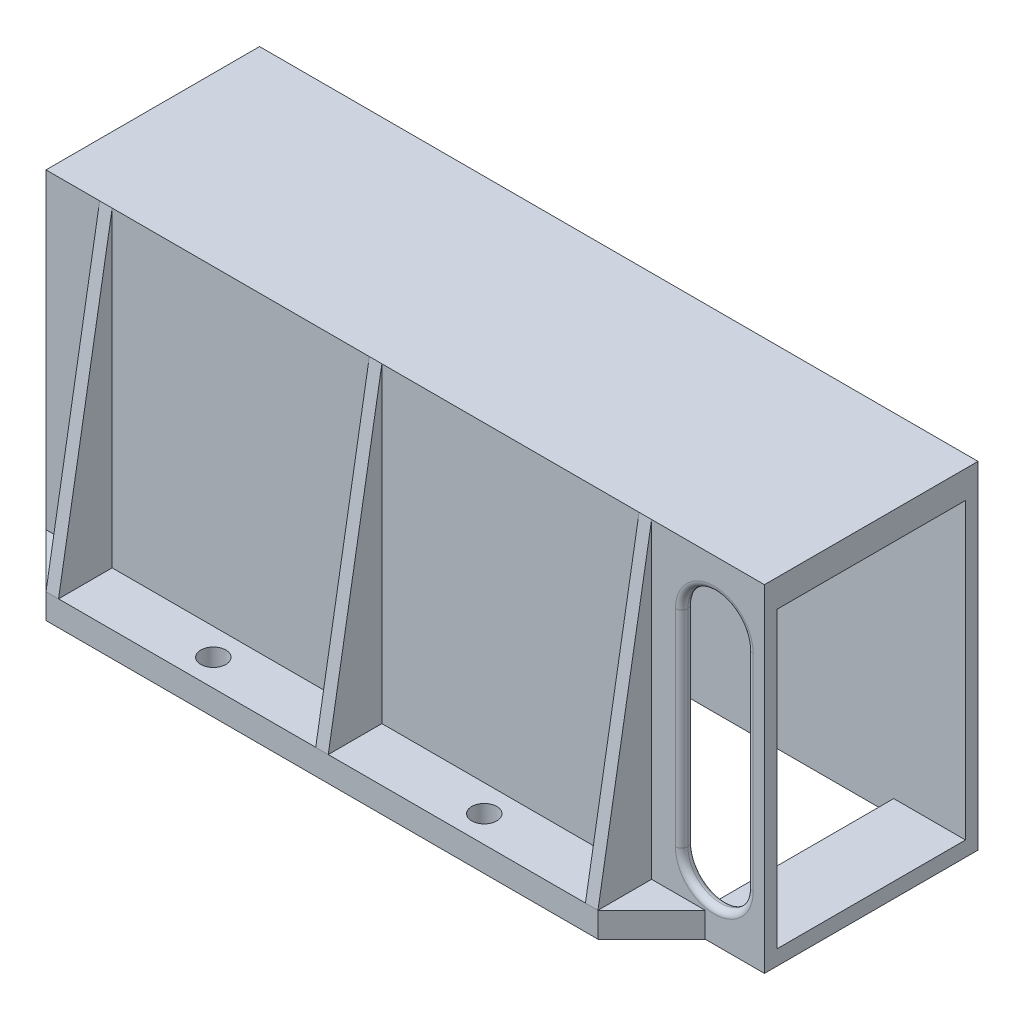
from build123d import *

# Parameters (mm, degrees)
SKETCH1_W                 = 166.85
SKETCH1_H                 = 54.05
SKETCH1_W_2               = 160.5
SKETCH1_H_2               = 47.7
BOSS_EXTRUDE1_DEPTH       = 3.81
BOSS_EXTRUDE2_DEPTH       = 78.232
SKETCH3_W                 = 166.85
SKETCH3_H                 = 54.05
BOSS_EXTRUDE5_DEPTH       = 3.175
SKETCH4_W                 = 3.175
SKETCH4_H                 = 54.05
BOSS_EXTRUDE6_DEPTH       = 3.81
BOSS_EXTRUDE7_DEPTH       = 6.35
BOSS_EXTRUDE9_DEPTH       = 3.175
BOSS_EXTRUDE10_DEPTH      = 3.175
SKETCH8_R                 = 3.175
CUT_EXTRUDE1_DEPTH        = 122.77066278
BOSS_EXTRUDE11_DEPTH      = 1.5875
BOSS_EXTRUDE11_DEPTH_BACK = 1.5875
SKETCH14_W                = 54.05
SKETCH14_H                = 85.217
SKETCH14_W_2              = 47.7
SKETCH14_H_2              = 74.422
BOSS_EXTRUDE13_DEPTH      = 14.986
CUT_EXTRUDE2_DEPTH        = 147.696293869
SKETCH16_W                = 160.5
SKETCH16_H                = 47.7
CUT_EXTRUDE3_DEPTH        = 1.5875
SKETCH17_W                = 18.712657602
SKETCH17_H                = 69.277031054
BOSS_EXTRUDE14_DEPTH      = 3.175
FILLET1_R                 = 1.5875


with BuildPart() as part:
    # Sketch1 → Boss-Extrude1 (new body)
    with BuildSketch(Plane(origin=(0, 0, 0), x_dir=(1, 0, 0), z_dir=(0, 1, 0))):
        Rectangle(SKETCH1_W, SKETCH1_H)
        Rectangle(SKETCH1_W_2, SKETCH1_H_2, mode=Mode.SUBTRACT)
    extrude(amount=BOSS_EXTRUDE1_DEPTH)

    # Sketch2 → Boss-Extrude2 (add)
    with BuildSketch(Plane(origin=(0, 3.81, 0), x_dir=(1, 0, 0), z_dir=(0, 1, 0))):
        Polygon((-83.425, 27.025), (83.425, 27.025), (83.425, 23.85), (80.25, 23.85), (-80.25, 23.85), (-80.25, -23.85), (80.25, -23.85), (83.425, -23.85), (83.425, -27.025), (-83.425, -27.025), align=None)
    extrude(amount=BOSS_EXTRUDE2_DEPTH)

    # Sketch3 → Boss-Extrude5 (add)
    with BuildSketch(Plane(origin=(0, 82.042, 0), x_dir=(1, 0, 0), z_dir=(0, 1, 0))):
        Rectangle(SKETCH3_W, SKETCH3_H)
    extrude(amount=BOSS_EXTRUDE5_DEPTH)

    # Sketch4 → Boss-Extrude6 (add)
    with BuildSketch(Plane.XZ.offset(-82.042)):
        with Locations((81.8375, 0)):
            Rectangle(SKETCH4_W, SKETCH4_H)
    extrude(amount=BOSS_EXTRUDE6_DEPTH)

    # Sketch5 → Boss-Extrude7 (add)
    with BuildSketch(Plane(origin=(0, 0, 0), x_dir=(1, 0, 0), z_dir=(0, 1, 0))):
        Polygon((-83.425, -27.025), (83.425, -27.025), (69.85, -40.6), (-69.85, -40.6), align=None)
        Polygon((-69.85, 40.6), (-83.425, 27.025), (83.425, 27.025), (69.85, 40.6), align=None)
    extrude(amount=BOSS_EXTRUDE7_DEPTH)

    # Sketch6 → Boss-Extrude9 (add)
    with BuildSketch(Plane.ZY.offset(69.85)):
        Polygon((27.025, 85.217), (27.025, 6.35), (40.6, 6.35), align=None)
        Polygon((-27.025, 85.217), (-40.6, 6.35), (-27.025, 6.35), align=None)
    extrude(amount=-BOSS_EXTRUDE9_DEPTH)

    # Sketch7 → Boss-Extrude10 (add)
    with BuildSketch(Plane(origin=(69.85, 0, 0), x_dir=(0, 0, -1), z_dir=(1, 0, 0))):
        Polygon((-27.025, 85.217), (-27.025, 6.35), (-40.6, 6.35), align=None)
        Polygon((40.6, 6.35), (27.025, 85.217), (27.025, 6.35), align=None)
    extrude(amount=-BOSS_EXTRUDE10_DEPTH)

    # Sketch8 → Cut-Extrude1 (cut, through all)
    with BuildSketch(Plane(origin=(0, 6.35, 0), x_dir=(1, 0, 0), z_dir=(0, 1, 0))):
        with Locations(Location((-34.29, -33.812500014, 0), (0, 0, 270))):
            Circle(SKETCH8_R)
        with Locations(Location((34.29, -33.812500014, 0), (0, 0, 90))):
            Circle(SKETCH8_R)
        with Locations(Location((34.29, 33.812500014, 0), (0, 0, 270))):
            Circle(SKETCH8_R)
        with Locations(Location((-34.29, 33.812500014, 0), (0, 0, 90))):
            Circle(SKETCH8_R)
    extrude(amount=-CUT_EXTRUDE1_DEPTH, mode=Mode.SUBTRACT)

    # Sketch11 → Boss-Extrude11 (add, two sides: drawn at the far end of the back side and taken through both)
    with BuildSketch(Plane(origin=(0, 0, 0), x_dir=(0, 0, -1), z_dir=(1, 0, 0)).offset(-BOSS_EXTRUDE11_DEPTH_BACK)):
        Polygon((-27.025, 85.217), (-27.025, 6.35), (-40.6, 6.35), align=None)
        Polygon((40.6, 6.35), (27.025, 85.217), (27.025, 6.35), align=None)
    extrude(amount=BOSS_EXTRUDE11_DEPTH + BOSS_EXTRUDE11_DEPTH_BACK)

    # Sketch14 → Boss-Extrude13 (add)
    with BuildSketch(Plane(origin=(98.411, 0, 0), x_dir=(0, 0, -1), z_dir=(1, 0, 0))):
        with Locations((0, 42.6085)):
            Rectangle(SKETCH14_W, SKETCH14_H)
        with Locations((0, 41.021)):
            Rectangle(SKETCH14_W_2, SKETCH14_H_2, mode=Mode.SUBTRACT)
    extrude(amount=-BOSS_EXTRUDE13_DEPTH)

    # Sketch15 → Cut-Extrude2 (cut, through all)
    with BuildSketch(Plane(origin=(0, 0, -27.025), x_dir=(-1, 0, 0), z_dir=(0, 0, -1))):
        with BuildLine():
            Line((-93.966, 68.707), (-93.966, 16.51))
            ThreePointArc((-93.966, 16.51), (-85.711, 8.255), (-77.456, 16.51))
            Line((-77.456, 16.51), (-77.456, 68.707))
            ThreePointArc((-77.456, 68.707), (-85.711, 76.962), (-93.966, 68.707))
        make_face()
    extrude(amount=-CUT_EXTRUDE2_DEPTH, mode=Mode.SUBTRACT)

    # Sketch16 → Cut-Extrude3 (cut)
    with BuildSketch(Plane.XZ.offset(-82.042)):
        Rectangle(SKETCH16_W, SKETCH16_H)
    extrude(amount=-CUT_EXTRUDE3_DEPTH, mode=Mode.SUBTRACT)

    # Sketch17 → Boss-Extrude14 (add)
    with BuildSketch(Plane(origin=(0, 0, -27.025), x_dir=(-1, 0, 0), z_dir=(0, 0, -1))):
        with Locations((-85.711, 42.6085)):
            Rectangle(SKETCH17_W, SKETCH17_H)
    extrude(amount=-BOSS_EXTRUDE14_DEPTH)

    # Fillet1
    fillet1_edges = [part.edges().sort_by_distance(p)[0] for p in [
        (85.711, 8.255, 23.85),
        (93.966, 42.6085, 23.85),
        (85.711, 76.962, 23.85),
        (85.711, 76.962, 27.025),
        (77.456, 42.6085, 27.025),
        (85.711, 8.255, 27.025),
        (77.456, 42.6085, 23.85),
        (93.966, 42.6085, 27.025),
    ]]
    fillet(fillet1_edges, radius=FILLET1_R - 0.0001)  # a hair under: the kernel refuses the full size


solid = part.part
